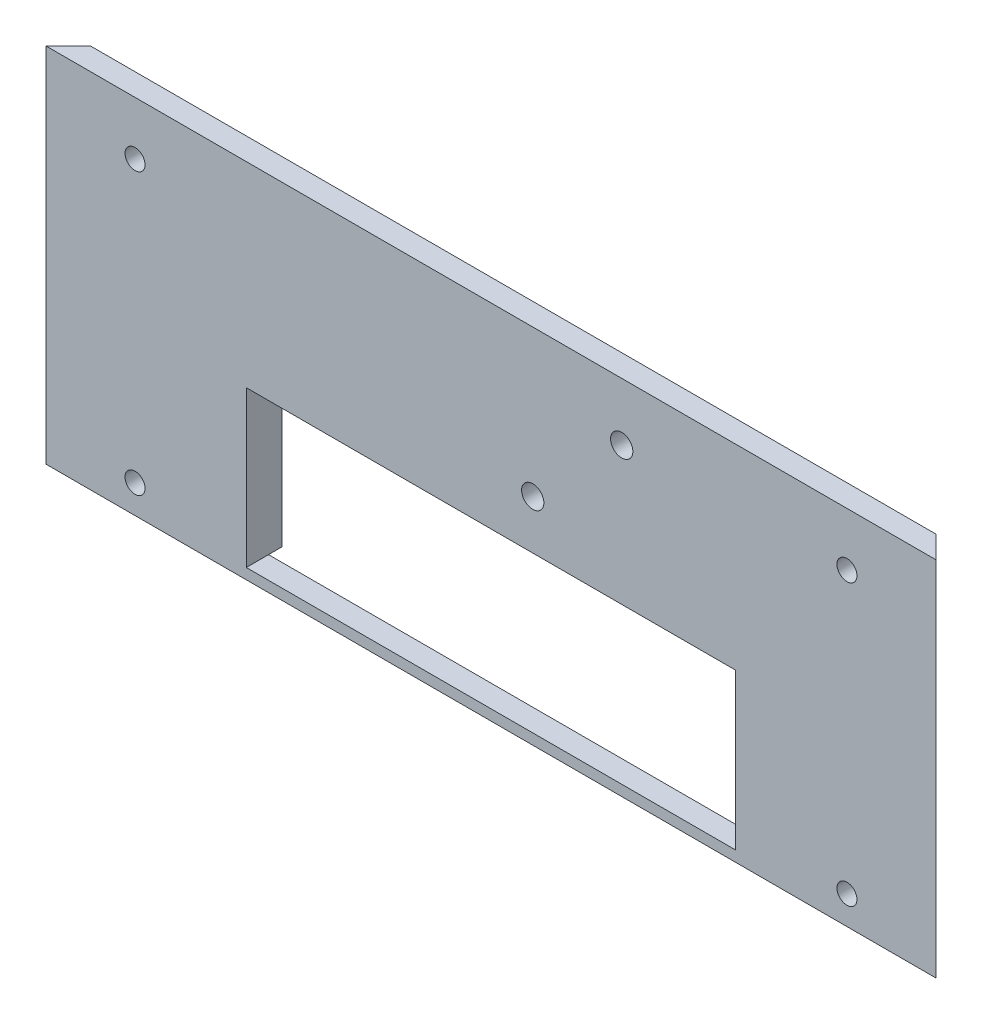
from build123d import *

# Parameters (mm, degrees)
SKETCH1_W               = 200
SKETCH1_H               = 84
SKETCH1_R               = 2.25
SKETCH1_R_2             = 2.5
BOSS_EXTRUDE1_DEPTH     = 5
SKETCH2_W               = 200
SKETCH2_H               = 79
SKETCH2_R               = 2.25
BOSS_EXTRUDE2_DEPTH     = 3
CHAMFER1_SIZE           = 8
CHAMFER3_SIZE           = 3
SKETCH3_W               = 7.071067812
SKETCH3_H               = 2.6
CUT_EXTRUDE1_DEPTH      = 234.034075139
SKETCH4_R               = 2.5
CUT_EXTRUDE2_DEPTH      = 218.071416819
CUT_EXTRUDE3_DEPTH      = 218.071416819
CUT_EXTRUDE3_DEPTH_BACK = 218.071416819
SKETCH6_W               = 110
SKETCH6_H               = 35


with BuildPart() as part:
    # Sketch1 → Boss-Extrude1 (new body)
    with BuildSketch(Plane.XY):
        with Locations((100, 42)):
            Rectangle(SKETCH1_W, SKETCH1_H)
        with Locations((20, 9)):
            Circle(SKETCH1_R, mode=Mode.SUBTRACT)
        with Locations(Location((180, 9, 0), (0, 0, 180))):
            Circle(SKETCH1_R, mode=Mode.SUBTRACT)
        with Locations((20, 72)):
            Circle(SKETCH1_R, mode=Mode.SUBTRACT)
        with Locations(Location((180, 72, 0), (0, 0, 180))):
            Circle(SKETCH1_R, mode=Mode.SUBTRACT)
        with Locations((109.377508284, 51)):
            Circle(SKETCH1_R_2, mode=Mode.SUBTRACT)
        with Locations((129.377508284, 71)):
            Circle(SKETCH1_R_2, mode=Mode.SUBTRACT)
    extrude(amount=-BOSS_EXTRUDE1_DEPTH)

    # Sketch2 → Boss-Extrude2 (add)
    with BuildSketch(Plane(origin=(0, 0, -5), x_dir=(-1, 0, 0), z_dir=(0, 0, -1))):
        with Locations((-100, 44.5)):
            Rectangle(SKETCH2_W, SKETCH2_H)
        with Locations(Location((-20, 9, 0), (0, 0, 180))):
            Circle(SKETCH2_R, mode=Mode.SUBTRACT)
        with Locations((-180, 9)):
            Circle(SKETCH2_R, mode=Mode.SUBTRACT)
        with Locations(Location((-20, 72, 0), (0, 0, 180))):
            Circle(SKETCH2_R, mode=Mode.SUBTRACT)
        with Locations((-180, 72)):
            Circle(SKETCH2_R, mode=Mode.SUBTRACT)
    extrude(amount=BOSS_EXTRUDE2_DEPTH)

    # Chamfer1
    # the kernel refuses this chamfer: 8 mm, written as the material it takes off along each edge
    with BuildSketch(Plane(origin=(200, -15.573463904, -8), x_dir=(-0.9996219169112968, 0, -0.027495876610586296), z_dir=(0, 1, 0)), Plane(origin=(0, 104.573463904, -8), x_dir=(0.9996219169112968, 0, -0.027495876610586275), z_dir=(0, -1, 0))) as chamfer1_piece_1:
        Polygon((CHAMFER1_SIZE * 0.999621916911, CHAMFER1_SIZE * 0.0274958766106), (-CHAMFER1_SIZE * 0.0274958766106, CHAMFER1_SIZE * 0.999621916911), (0, 0), align=None)
    extrude(amount=120.146927807, mode=Mode.SUBTRACT)

    # Chamfer3
    chamfer3_edges = [part.edges().sort_by_distance(p)[0] for p in [
        (100, 84, -8),
    ]]
    chamfer(chamfer3_edges, length=CHAMFER3_SIZE)

    # Sketch3 → Cut-Extrude1 (cut, through all, along a direction that is not the sketch's normal)
    with BuildSketch(Plane(origin=(100, 0, -100), x_dir=(-0.7071067811865452, 0, -0.7071067811865498), z_dir=(0.7071067811865498, 0, -0.7071067811865452))):
        with Locations((-137.885822331, 1.3)):
            Rectangle(SKETCH3_W, SKETCH3_H)
    extrude(amount=-CUT_EXTRUDE1_DEPTH, dir=(1, 0, 0), mode=Mode.SUBTRACT)

    # Sketch4 → Cut-Extrude2 (cut, through all)
    with BuildSketch(Plane.XY):
        with Locations((129.377508284, 71)):
            Circle(SKETCH4_R)
        with Locations((109.377508284, 51)):
            Circle(SKETCH4_R)
    extrude(amount=-CUT_EXTRUDE2_DEPTH, mode=Mode.SUBTRACT)

    # Sketch6 → Cut-Extrude3 (cut, two sides: drawn at the far end of the back side and taken through both)
    with BuildSketch(Plane(origin=(0, 0, -8), x_dir=(-1, 0, 0), z_dir=(0, 0, -1)).offset(-CUT_EXTRUDE3_DEPTH_BACK)):
        with Locations((-100, 22.5)):
            Rectangle(SKETCH6_W, SKETCH6_H)
    extrude(amount=CUT_EXTRUDE3_DEPTH + CUT_EXTRUDE3_DEPTH_BACK, mode=Mode.SUBTRACT)


solid = part.part
